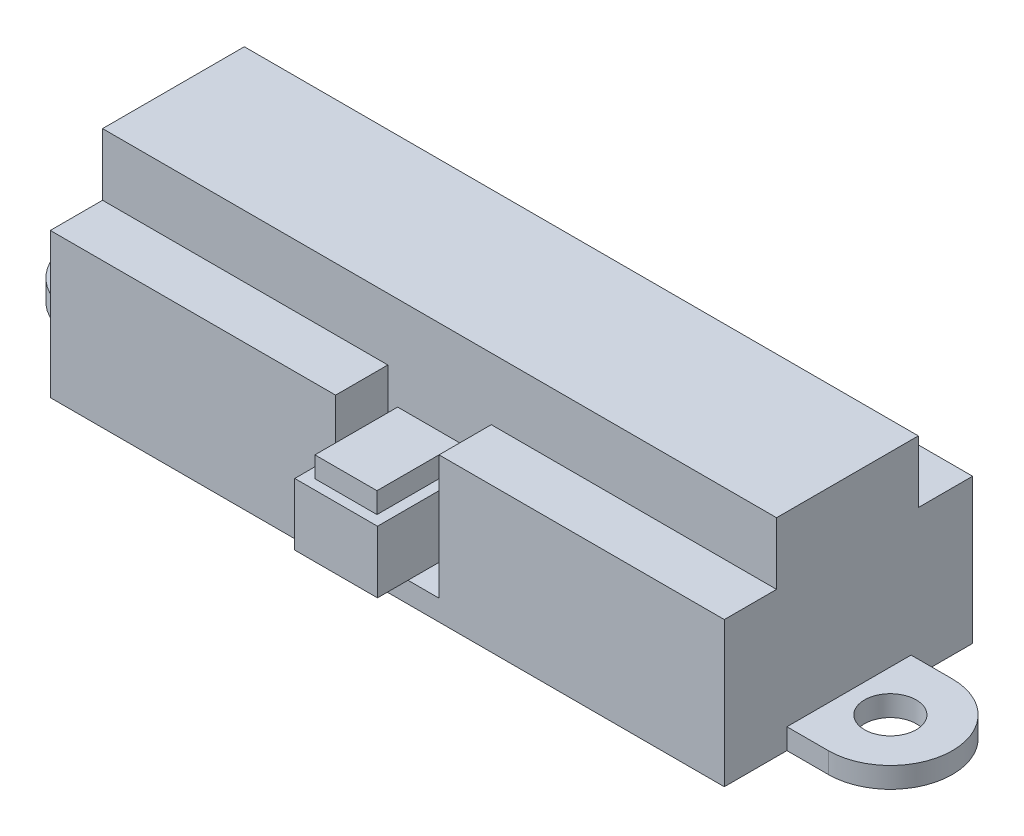
from build123d import *

# Parameters (mm, degrees)
SKETCH1_W               = 32.576000126
SKETCH1_H               = 12
BOSS_EXTRUDE1_DEPTH     = 7
SKETCH2_W               = 32.576000126
SKETCH2_H               = 6.852850135
BOSS_EXTRUDE2_DEPTH     = 3
SKETCH3_R               = 0.9
BOSS_EXTRUDE3_DEPTH     = 1
BOSS_EXTRUDE5_START     = -1
BOSS_EXTRUDE5_OUTLINE_R = 1.25
BOSS_EXTRUDE5_DEPTH     = 1
SKETCH5_W               = 5
SKETCH5_H               = 2.525
CUT_EXTRUDE2_DEPTH      = 6
SKETCH6_W               = 4
SKETCH6_H               = 4
BOSS_EXTRUDE6_DEPTH     = 5
SKETCH7_W               = 4
SKETCH7_H               = 5
SKETCH7_W_2             = 3
SKETCH7_H_2             = 4
CUT_EXTRUDE4_DEPTH      = 1


# Read off the part's stored shape, not the designer's step: Boss-Extrude5
with BuildPart() as part:
    # Sketch1 → Boss-Extrude1 (new body)
    with BuildSketch(Plane(origin=(0, 0, 0), x_dir=(1, 0, 0), z_dir=(0, 1, 0))):
        with Locations((16.288000063, 6)):
            Rectangle(SKETCH1_W, SKETCH1_H)
    extrude(amount=BOSS_EXTRUDE1_DEPTH)

    # Sketch2 → Boss-Extrude2 (add)
    with BuildSketch(Plane(origin=(0, 7, 0), x_dir=(1, 0, 0), z_dir=(0, 1, 0))):
        with Locations((16.288000063, 5.951425068)):
            Rectangle(SKETCH2_W, SKETCH2_H)
    extrude(amount=BOSS_EXTRUDE2_DEPTH)

    # Sketch3 → Boss-Extrude3 (add)
    with BuildSketch(Plane.XZ):
        with BuildLine():
            ThreePointArc((19.788000063, -14.5), (20.495106844, -14.207106781), (20.788000063, -13.5))
            Line((20.788000063, -13.5), (20.788000063, -12))
            Line((20.788000063, -12), (11.788000063, -12))
            Line((11.788000063, -12), (11.788000063, -13.5))
            ThreePointArc((11.788000063, -13.5), (12.080893282, -14.207106781), (12.788000063, -14.5))
            Line((12.788000063, -14.5), (19.788000063, -14.5))
        make_face()
        with Locations(Location((13.288000063, -13.25, 0), (0, 0, 270))):
            Circle(SKETCH3_R, mode=Mode.SUBTRACT)
        with Locations(Location((16.288000063, -13.25, 0), (0, 0, 270))):
            Circle(SKETCH3_R, mode=Mode.SUBTRACT)
        with Locations(Location((19.288000063, -13.25, 0), (0, 0, 270))):
            Circle(SKETCH3_R, mode=Mode.SUBTRACT)
    extrude(amount=-BOSS_EXTRUDE3_DEPTH)

    # Boss-Extrude5 outline → Boss-Extrude5 (add)
    # profile 1 of 2: a face of its own
    with BuildSketch(Plane.XZ.offset(BOSS_EXTRUDE5_START)):
        with BuildLine():
            Line((32.576000126, -9.026382535), (34.576, -9.026382535))
            ThreePointArc((34.576, -9.026382535), (37.576, -6.026382535), (34.576, -3.026382535))
            Line((34.576, -3.026382535), (32.576000126, -3.026382535))
            Line((32.576000126, -3.026382535), (32.576000126, -9.026382535))
        make_face()
        with Locations((34.576, -6.026382535)):
            Circle(BOSS_EXTRUDE5_OUTLINE_R, mode=Mode.SUBTRACT)
    # profile 2 of 2: a face of its own
    with BuildSketch(Plane.XZ.offset(BOSS_EXTRUDE5_START)):
        with BuildLine():
            Line((-2, -9.026382535), (0, -9.026382535))
            Line((0, -9.026382535), (0, -3.026382535))
            Line((0, -3.026382535), (-2, -3.026382535))
            ThreePointArc((-2, -3.026382535), (-5, -6.026382535), (-2, -9.026382535))
        make_face()
        with Locations((-2, -6.026382535)):
            Circle(BOSS_EXTRUDE5_OUTLINE_R, mode=Mode.SUBTRACT)
    extrude(amount=BOSS_EXTRUDE5_DEPTH)

    # Sketch5 → Cut-Extrude2 (cut)
    with BuildSketch(Plane(origin=(0, 7, 0), x_dir=(1, 0, 0), z_dir=(0, 1, 0))):
        with Locations((16.288000063, 1.2625)):
            Rectangle(SKETCH5_W, SKETCH5_H)
    extrude(amount=-CUT_EXTRUDE2_DEPTH, mode=Mode.SUBTRACT)

    # Sketch6 → Boss-Extrude6 (add)
    with BuildSketch(Plane.XY.offset(-2.525)):
        with Locations((16.288000063, 4)):
            Rectangle(SKETCH6_W, SKETCH6_H)
    extrude(amount=BOSS_EXTRUDE6_DEPTH)

    # Sketch7 → Cut-Extrude4 (cut)
    with BuildSketch(Plane(origin=(0, 6, 0), x_dir=(1, 0, 0), z_dir=(0, 1, 0))):
        with Locations((16.288000063, 0.025)):
            Rectangle(SKETCH7_W, SKETCH7_H)
        with Locations((16.288000063, 0)):
            Rectangle(SKETCH7_W_2, SKETCH7_H_2, mode=Mode.SUBTRACT)
    extrude(amount=-CUT_EXTRUDE4_DEPTH, mode=Mode.SUBTRACT)


solid = part.part
